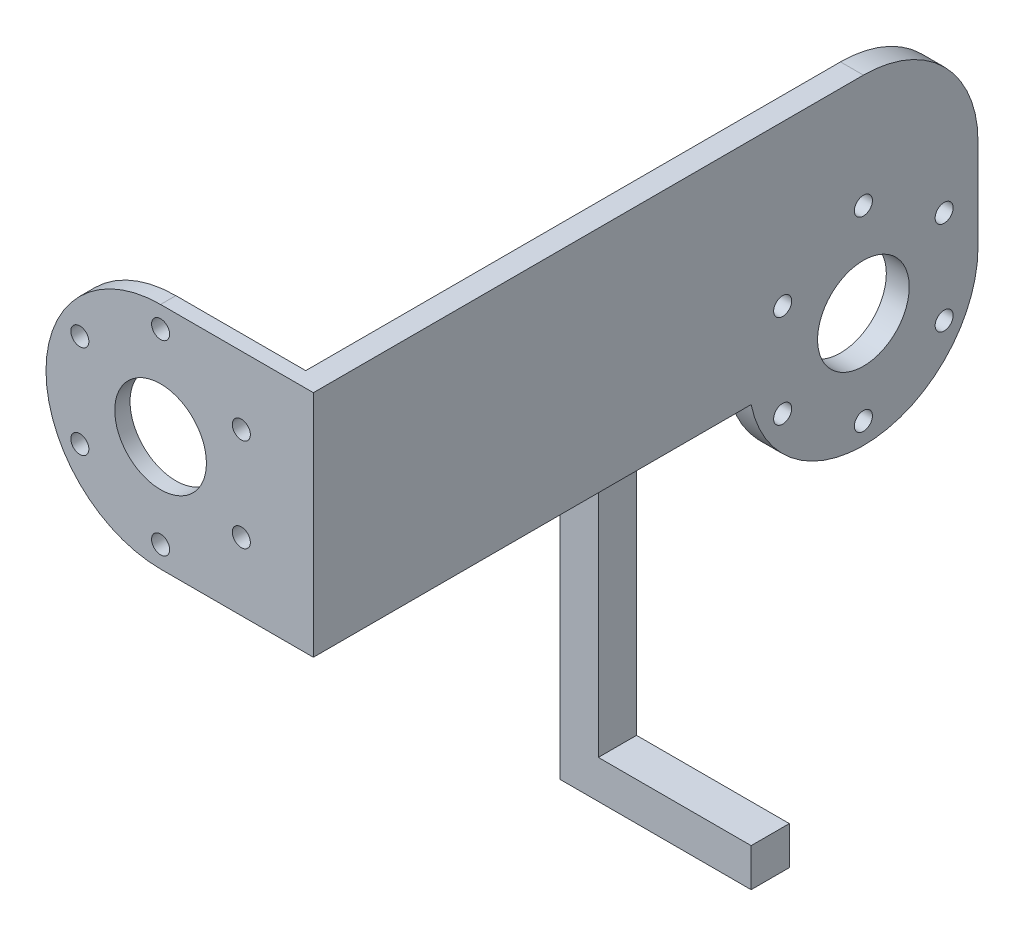
from build123d import *

# Parameters (mm, degrees)
SKETCH1_W           = 50.8
SKETCH1_H           = 38.1
SKETCH1_R           = 1.5
SKETCH1_R_2         = 7.62
BOSS_EXTRUDE1_DEPTH = 2.54
CUT_EXTRUDE1_REACH  = 33.851
SKETCH4_R           = 19.05
SKETCH4_W           = 91.44
SKETCH4_H           = 38.1
SKETCH4_W_2         = 38.1
SKETCH4_H_2         = 15.24
BOSS_EXTRUDE2_DEPTH = 3.81
CUT_EXTRUDE2_REACH  = 123.675
SKETCH5_R           = 7.62
SKETCH5_R_2         = 1.5
SKETCH6_W           = 19.05
SKETCH6_H           = 6.35
BOSS_EXTRUDE3_DEPTH = 6.35
SKETCH7_W           = 6.35
SKETCH7_H           = 6.35
BOSS_EXTRUDE4_DEPTH = 57.15
SKETCH8_W           = 6.35
SKETCH8_H           = 6.35
BOSS_EXTRUDE5_DEPTH = 25.4


with BuildPart() as part:
    # Sketch1 → Boss-Extrude1 (new body)
    with BuildSketch(Plane.XY):
        Rectangle(SKETCH1_W, SKETCH1_H)
        with Locations((0, 15.5)):
            Circle(SKETCH1_R, mode=Mode.SUBTRACT)
        with Locations((13.423393759, 7.75)):
            Circle(SKETCH1_R, mode=Mode.SUBTRACT)
        with Locations((13.423393759, -7.75)):
            Circle(SKETCH1_R, mode=Mode.SUBTRACT)
        with Locations((0, -15.5)):
            Circle(SKETCH1_R, mode=Mode.SUBTRACT)
        with Locations((-13.423393759, -7.75)):
            Circle(SKETCH1_R, mode=Mode.SUBTRACT)
        with Locations((-13.423393759, 7.75)):
            Circle(SKETCH1_R, mode=Mode.SUBTRACT)
        Circle(SKETCH1_R_2, mode=Mode.SUBTRACT)
    extrude(amount=BOSS_EXTRUDE1_DEPTH)

    # Sketch2 → Cut-Extrude1 (cut, up to next)
    with BuildSketch(Plane.XY.offset(2.54), mode=Mode.PRIVATE) as cut_extrude1_sk1:
        with BuildLine():
            Line((0, 19.05), (-25.4, 19.05))
            Line((-25.4, 19.05), (-25.4, -19.05))
            Line((-25.4, -19.05), (0, -19.05))
            ThreePointArc((0, -19.05), (-19.05, 0), (0, 19.05))
        make_face()
    cut_extrude1_tool1 = extrude(cut_extrude1_sk1.sketch, amount=-CUT_EXTRUDE1_REACH, mode=Mode.PRIVATE) & part.part
    add(cut_extrude1_tool1.solids().sort_by_distance((-19.314937, 0, 2.54))[0], mode=Mode.SUBTRACT)

    # Sketch4 → Boss-Extrude2 (add)
    with BuildSketch(Plane(origin=(25.4, 0, 0), x_dir=(0, 0, -1), z_dir=(1, 0, 0))):
        with Locations((88.9, 0)):
            Circle(SKETCH4_R)
        with Locations((88.9, -15.24)):
            Circle(SKETCH4_R)
        with Locations((43.18, 0)):
            Rectangle(SKETCH4_W, SKETCH4_H)
        with Locations((88.9, -7.62)):
            Rectangle(SKETCH4_W_2, SKETCH4_H_2)
    extrude(amount=-BOSS_EXTRUDE2_DEPTH)

    # Sketch5 → Cut-Extrude2 (cut, up to next)
    with BuildSketch(Plane(origin=(25.4, 0, 0), x_dir=(0, 0, -1), z_dir=(1, 0, 0)), mode=Mode.PRIVATE) as cut_extrude2_sk1:
        with Locations((88.9, -15.24)):
            Circle(SKETCH5_R)
    cut_extrude2_tool1 = extrude(cut_extrude2_sk1.sketch, amount=-CUT_EXTRUDE2_REACH, mode=Mode.PRIVATE) & part.part
    # Sketch5 → Cut-Extrude2 (cut, up to next)
    with BuildSketch(Plane(origin=(25.4, 0, 0), x_dir=(0, 0, -1), z_dir=(1, 0, 0)), mode=Mode.PRIVATE) as cut_extrude2_sk2:
        with Locations((88.9, 0.26)):
            Circle(SKETCH5_R_2)
    cut_extrude2_tool2 = extrude(cut_extrude2_sk2.sketch, amount=-CUT_EXTRUDE2_REACH, mode=Mode.PRIVATE) & part.part
    # Sketch5 → Cut-Extrude2 (cut, up to next)
    with BuildSketch(Plane(origin=(25.4, 0, 0), x_dir=(0, 0, -1), z_dir=(1, 0, 0)), mode=Mode.PRIVATE) as cut_extrude2_sk3:
        with Locations((102.323393759, -7.49)):
            Circle(SKETCH5_R_2)
    cut_extrude2_tool3 = extrude(cut_extrude2_sk3.sketch, amount=-CUT_EXTRUDE2_REACH, mode=Mode.PRIVATE) & part.part
    # Sketch5 → Cut-Extrude2 (cut, up to next)
    with BuildSketch(Plane(origin=(25.4, 0, 0), x_dir=(0, 0, -1), z_dir=(1, 0, 0)), mode=Mode.PRIVATE) as cut_extrude2_sk4:
        with Locations((102.323393759, -22.99)):
            Circle(SKETCH5_R_2)
    cut_extrude2_tool4 = extrude(cut_extrude2_sk4.sketch, amount=-CUT_EXTRUDE2_REACH, mode=Mode.PRIVATE) & part.part
    # Sketch5 → Cut-Extrude2 (cut, up to next)
    with BuildSketch(Plane(origin=(25.4, 0, 0), x_dir=(0, 0, -1), z_dir=(1, 0, 0)), mode=Mode.PRIVATE) as cut_extrude2_sk5:
        with Locations((88.9, -30.74)):
            Circle(SKETCH5_R_2)
    cut_extrude2_tool5 = extrude(cut_extrude2_sk5.sketch, amount=-CUT_EXTRUDE2_REACH, mode=Mode.PRIVATE) & part.part
    # Sketch5 → Cut-Extrude2 (cut, up to next)
    with BuildSketch(Plane(origin=(25.4, 0, 0), x_dir=(0, 0, -1), z_dir=(1, 0, 0)), mode=Mode.PRIVATE) as cut_extrude2_sk6:
        with Locations((75.476606241, -22.99)):
            Circle(SKETCH5_R_2)
    cut_extrude2_tool6 = extrude(cut_extrude2_sk6.sketch, amount=-CUT_EXTRUDE2_REACH, mode=Mode.PRIVATE) & part.part
    # Sketch5 → Cut-Extrude2 (cut, up to next)
    with BuildSketch(Plane(origin=(25.4, 0, 0), x_dir=(0, 0, -1), z_dir=(1, 0, 0)), mode=Mode.PRIVATE) as cut_extrude2_sk7:
        with Locations((75.476606241, -7.49)):
            Circle(SKETCH5_R_2)
    cut_extrude2_tool7 = extrude(cut_extrude2_sk7.sketch, amount=-CUT_EXTRUDE2_REACH, mode=Mode.PRIVATE) & part.part
    add(cut_extrude2_tool1.solids().sort_by_distance((25.4, -15.24, -88.9))[0], mode=Mode.SUBTRACT)
    add(cut_extrude2_tool2.solids().sort_by_distance((25.4, 0.26, -88.9))[0], mode=Mode.SUBTRACT)
    add(cut_extrude2_tool3.solids().sort_by_distance((25.4, -7.49, -102.323394))[0], mode=Mode.SUBTRACT)
    add(cut_extrude2_tool4.solids().sort_by_distance((25.4, -22.99, -102.323394))[0], mode=Mode.SUBTRACT)
    add(cut_extrude2_tool5.solids().sort_by_distance((25.4, -30.74, -88.9))[0], mode=Mode.SUBTRACT)
    add(cut_extrude2_tool6.solids().sort_by_distance((25.4, -22.99, -75.476606))[0], mode=Mode.SUBTRACT)
    add(cut_extrude2_tool7.solids().sort_by_distance((25.4, -7.49, -75.476606))[0], mode=Mode.SUBTRACT)

    # Sketch6 → Boss-Extrude3 (add)
    with BuildSketch(Plane.XZ.offset(19.05)):
        with Locations((15.875, -60.70988816)):
            Rectangle(SKETCH6_W, SKETCH6_H)
    extrude(amount=-BOSS_EXTRUDE3_DEPTH)

    # Sketch7 → Boss-Extrude4 (add)
    with BuildSketch(Plane.XZ.offset(19.05)):
        with Locations((9.525, -60.70988816)):
            Rectangle(SKETCH7_W, SKETCH7_H)
    extrude(amount=BOSS_EXTRUDE4_DEPTH)

    # Sketch8 → Boss-Extrude5 (add)
    with BuildSketch(Plane(origin=(12.7, 0, 0), x_dir=(0, 0, -1), z_dir=(1, 0, 0))):
        with Locations((60.70988816, -73.025)):
            Rectangle(SKETCH8_W, SKETCH8_H)
    extrude(amount=BOSS_EXTRUDE5_DEPTH)


solid = part.part
